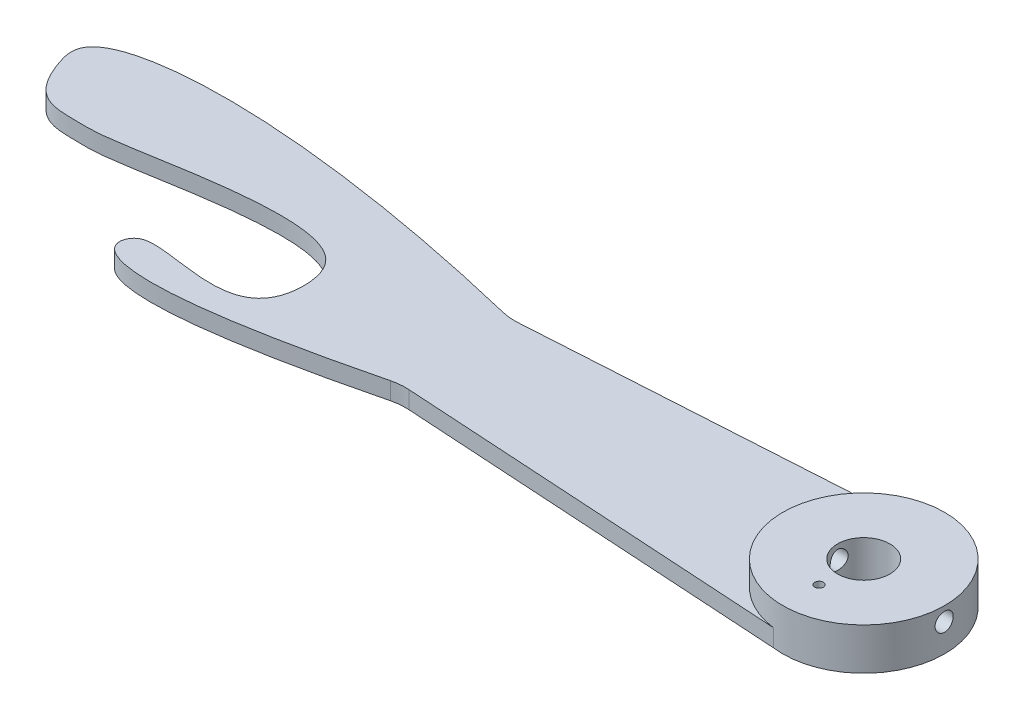
from build123d import *

# Parameters (mm, degrees)
SKETCH1_R           = 2.38125
BOSS_EXTRUDE1_DEPTH = 1.5875
SKETCH2_R           = 7.366
SKETCH2_R_2         = 2.38125
BOSS_EXTRUDE2_DEPTH = 3.81
SKETCH3_R           = 0.8255
CUT_EXTRUDE1_DEPTH  = 89.579570738
CUT_EXTRUDE2_REACH  = 90.58
SKETCH4_R           = 0.3937


with BuildPart() as part:
    # Sketch1 → Boss-Extrude1 (new body)
    with BuildSketch(Plane(origin=(0, 0, 0), x_dir=(1, 0, 0), z_dir=(0, 1, 0))):
        with BuildLine():
            ThreePointArc((-43.951973211, 17.819947783), (-44.708115332, 17.829917849), (-45.45439966, 17.952024415))
            add(Edge.make_bspline(
                [(-45.206452202, 7.429700561), (-68.738523066, 1.552203014), (-69.254897706, 6.743344307), (-65.403265288, 8.168741518), (-55.67763282, 4.255334519), (-57.322084941, 18.140656412), (-75.939337119, 13.465494207), (-81.606998932, 13.701717529), (-84.305263033, 13.403231742), (-86.882917877, 22.67609886), (-69.331802864, 23.711298497), (-45.45439966, 17.952024415)],
                knots=[0.001526992, 0.001526992, 0.001526992, 0.001526992, 0.145525509, 0.192265369, 0.438185566, 0.489914764, 0.657828152, 0.69815608, 0.852866112, 0.884867633, 0.998832538, 0.998832538, 0.998832538, 0.998832538], degree=3))
            ThreePointArc((-45.206452202, 7.429700561), (-44.440116554, 7.559809493), (-43.662902006, 7.571480261))
            Line((-43.662902006, 7.571480261), (-7.366, 5.334))
            ThreePointArc((-7.366, 5.334), (0, 12.7), (-7.366, 20.066))
            Line((-7.366, 20.066), (-43.951973211, 17.819947783))
        make_face()
        with Locations((-7.366, 12.7)):
            Circle(SKETCH1_R, mode=Mode.SUBTRACT)
    extrude(amount=BOSS_EXTRUDE1_DEPTH)

    # Sketch2 → Boss-Extrude2 (add)
    with BuildSketch(Plane.XZ):
        with Locations((-7.366, -12.7)):
            Circle(SKETCH2_R)
        with Locations((-7.366, -12.7)):
            Circle(SKETCH2_R_2, mode=Mode.SUBTRACT)
    extrude(amount=-BOSS_EXTRUDE2_DEPTH)

    # Sketch3 → Cut-Extrude1 (cut, through all)
    with BuildSketch(Plane(origin=(0, 0, 0), x_dir=(0, 0, -1), z_dir=(1, 0, 0))):
        with Locations((12.7, 2.54)):
            Circle(SKETCH3_R)
    extrude(amount=-CUT_EXTRUDE1_DEPTH, mode=Mode.SUBTRACT)

    # Sketch4 → Cut-Extrude2 (cut, up to next)
    with BuildSketch(Plane(origin=(0, 3.81, 0), x_dir=(1, 0, 0), z_dir=(0, 1, 0)), mode=Mode.PRIVATE) as cut_extrude2_sk1:
        with Locations((-7.366, 8.636)):
            Circle(SKETCH4_R)
    cut_extrude2_tool1 = extrude(cut_extrude2_sk1.sketch, amount=-CUT_EXTRUDE2_REACH, mode=Mode.PRIVATE) & part.part
    add(cut_extrude2_tool1.solids().sort_by_distance((-7.366, 3.81, -8.636))[0], mode=Mode.SUBTRACT)


solid = part.part
